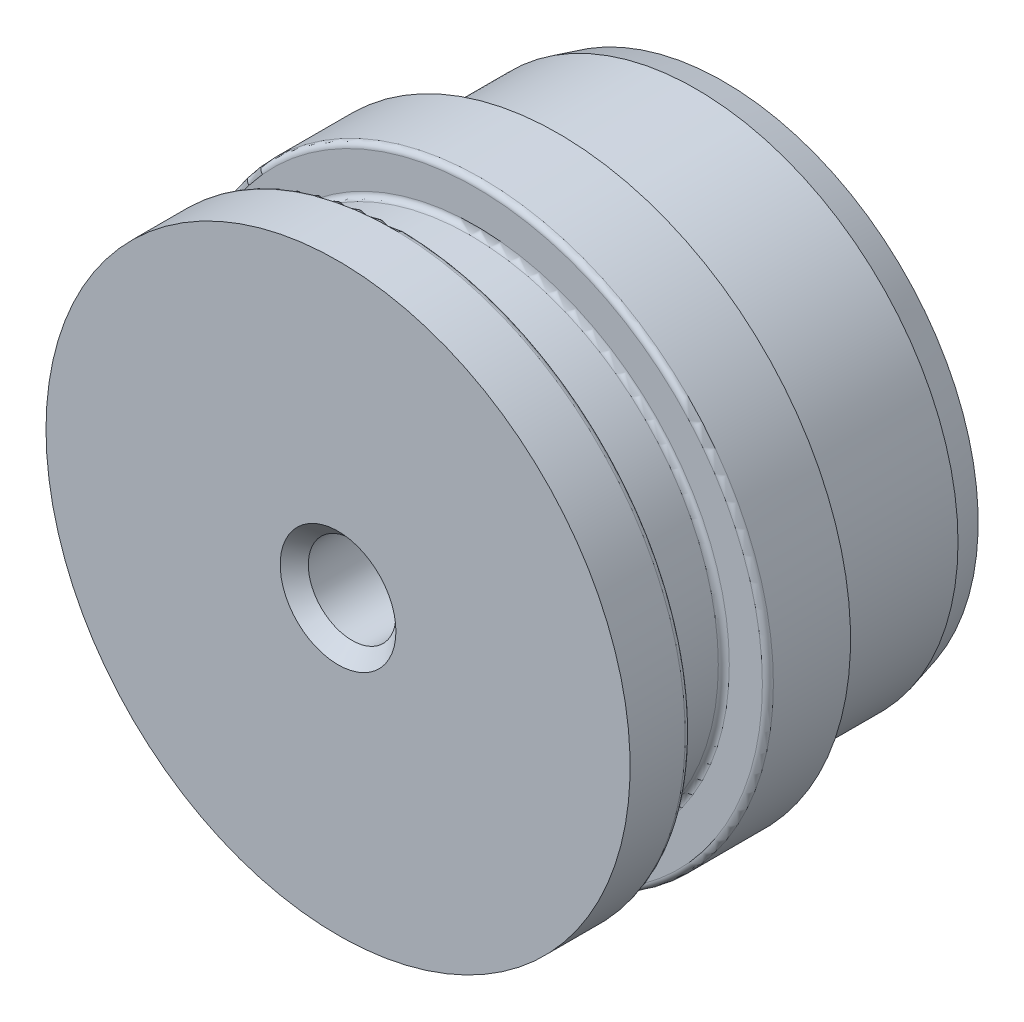
from build123d import *

# Parameters (mm, degrees)
F_6_32_TAPPED_HOLE1_D            = 2.7051
F_6_32_TAPPED_HOLE1_DEPTH        = 9.398
F_6_32_TAPPED_HOLE1_TIP          = 0.81269403
CHAMFER1_SIZE                    = 1.27
CHAMFER1_SIZE2                   = 0.462242198
F_10_32_TAPPED_HOLE2_D           = 4.0386
F_10_32_TAPPED_HOLE2_DEPTH       = 5.9944
F_10_32_TAPPED_HOLE2_CSINK_D     = 5.334
F_10_32_TAPPED_HOLE2_CSINK_ANGLE = 90
F_10_32_TAPPED_HOLE2_TIP         = 1.213317848
FILLET1_R                        = 0.254
CHAMFER2_SIZE                    = 1.27
CHAMFER2_SIZE2                   = 0.340295474


with BuildPart() as part:
    # Sketch1 → Revolve1 (revolve)
    with BuildSketch(Plane(origin=(0, 0, 0), x_dir=(0, 0, -1), z_dir=(1, 0, 0))):
        Polygon((0, 0), (0, 13.462), (2.794, 13.462), (2.794, 11.43), (6.35, 11.43), (6.35, 13.462), (10.16, 13.462), (10.16, 12.065), (17.78, 12.065), (17.78, 5.5118), (12.192, 5.5118), (12.192, 0), align=None)
    revolve(axis=Axis((0, 0, -12.192), (0, 0, 1)))

    # #6-32 Tapped Hole1
    with Locations(Plane(origin=(4.52225484, 6.077033904, -17.78), x_dir=(-1, 0, 0), z_dir=(0, 0, -1))):
        with Locations((-2.626784868, -1.949533904), (4.52225484, -14.332033904), (11.671294548, -1.949533904)):
            Hole(F_6_32_TAPPED_HOLE1_D / 2, depth=F_6_32_TAPPED_HOLE1_DEPTH)
            with Locations((0, 0, -(F_6_32_TAPPED_HOLE1_DEPTH + F_6_32_TAPPED_HOLE1_TIP / 2))):  # 118° drill point
                Cone(0, F_6_32_TAPPED_HOLE1_D / 2, F_6_32_TAPPED_HOLE1_TIP, mode=Mode.SUBTRACT)

    # Chamfer1
    chamfer1_edges = [part.edges().sort_by_distance(p)[0] for p in [
        (0, -5.5118, -17.78),
    ]]
    chamfer1_side = [part.faces().sort_by_distance(p)[0] for p in [
        (0, -5.5118, -14.986),
    ]]
    chamfer(chamfer1_edges, length=CHAMFER1_SIZE, length2=CHAMFER1_SIZE2, reference=chamfer1_side[0])

    # Sketch15 → Church tap on CL (revolve, cut)
    with BuildSketch(Plane(origin=(0, 0, 0), x_dir=(0, 0, -1), z_dir=(1, 0, 0))):
        Polygon((10.414, 0.508), (17.78, 0.508), (17.78, 0), (0, 0), (0, 2.0193), (6.604, 2.0193), (6.962810512, 1.422139028), (8.532276841, 0.8509), (10.414, 0.8509), align=None)
    revolve(axis=Axis((0, 0, -17.643825074), (0, 0, -1)), mode=Mode.SUBTRACT)

    # #10-32 Tapped Hole2
    with Locations(Plane.XY):
        with Locations((0, 0)):
            CounterSinkHole(F_10_32_TAPPED_HOLE2_D / 2, F_10_32_TAPPED_HOLE2_CSINK_D / 2, depth=F_10_32_TAPPED_HOLE2_DEPTH, counter_sink_angle=F_10_32_TAPPED_HOLE2_CSINK_ANGLE)
            with Locations((0, 0, -(F_10_32_TAPPED_HOLE2_DEPTH + F_10_32_TAPPED_HOLE2_TIP / 2))):  # 118° drill point
                Cone(0, F_10_32_TAPPED_HOLE2_D / 2, F_10_32_TAPPED_HOLE2_TIP, mode=Mode.SUBTRACT)

    # Fillet1
    fillet1_edges = [part.edges().sort_by_distance(p)[0] for p in [
        (0, -11.43, -2.794),
        (0, -11.43, -6.35),
        (0, -13.462, -6.35),
        (0, -13.462, -2.794),
    ]]
    fillet(fillet1_edges, radius=FILLET1_R)

    # Chamfer2
    chamfer2_edges = [part.edges().sort_by_distance(p)[0] for p in [
        (0, -12.065, -17.78),
    ]]
    chamfer2_side = [part.faces().sort_by_distance(p)[0] for p in [
        (0, -12.065, -13.97),
    ]]
    chamfer(chamfer2_edges, length=CHAMFER2_SIZE, length2=CHAMFER2_SIZE2, reference=chamfer2_side[0])


solid = part.part
